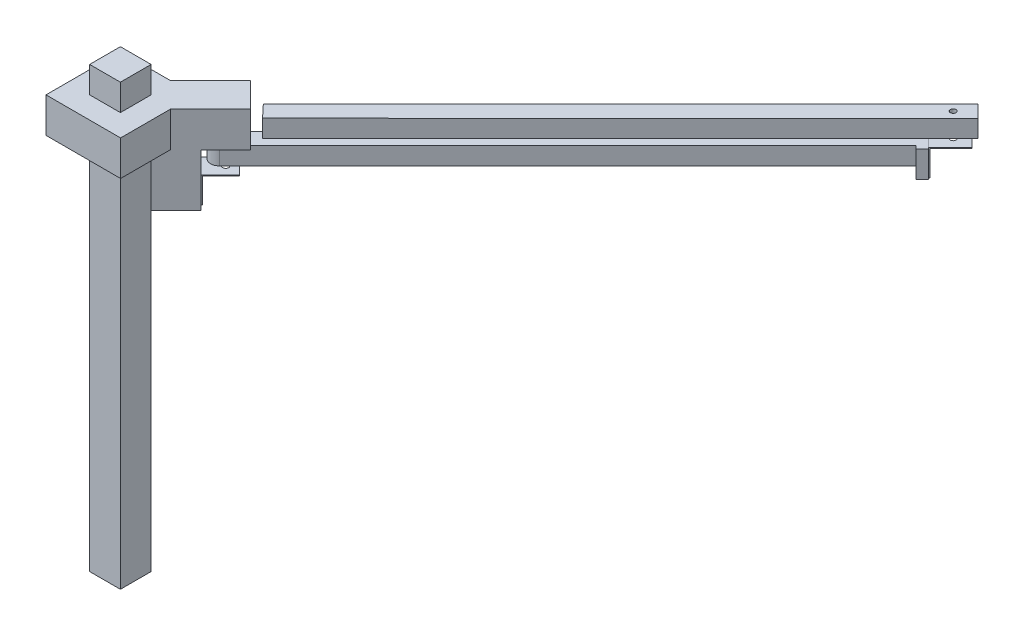
from build123d import *

# Parameters (mm, degrees)
SKETCH2_W                = 35
SKETCH2_H                = 35
BOSS_EXTRUDE1_DEPTH      = 500
BOSS_EXTRUDE2_DEPTH      = 20
BOSS_EXTRUDE2_DEPTH_BACK = 20
SKETCH6_W                = 84.911353559
SKETCH6_H                = 84.911353559
BOSS_EXTRUDE9_DEPTH      = 40
SKETCH7_W                = 25
SKETCH7_H                = 30
BOSS_EXTRUDE10_DEPTH     = 1.2
SKETCH9_W                = 25
SKETCH9_H                = 1.2
BOSS_EXTRUDE11_DEPTH     = 30
SKETCH10_R               = 3.5
CUT_EXTRUDE1_DEPTH       = 30
BOSS_EXTRUDE12_DEPTH     = 20
FILLET1_R                = 10
CUT_EXTRUDE2_DEPTH       = 20
CUT_EXTRUDE2_DEPTH_BACK  = 30
SKETCH15_W               = 30
SKETCH15_H               = 30
BOSS_EXTRUDE14_DEPTH     = 10
SKETCH16_W               = 25
SKETCH16_H               = 30
BOSS_EXTRUDE15_DEPTH     = 1.2
SKETCH17_W               = 25
SKETCH17_H               = 1.2
BOSS_EXTRUDE16_DEPTH     = 34
SKETCH18_R               = 3.192669461
CUT_EXTRUDE3_DEPTH       = 4
SKETCH19_R               = 3.192669461
BOSS_EXTRUDE18_DEPTH     = 20
SKETCH20_R               = 3.5
CUT_EXTRUDE4_DEPTH       = 20


with BuildPart() as part:
    # Sketch2 → Boss-Extrude1 (new body)
    with BuildSketch(Plane(origin=(0, 0, 0), x_dir=(1, 0, 0), z_dir=(0, 1, 0))):
        with Locations((-482.5, -482.5)):
            Rectangle(SKETCH2_W, SKETCH2_H)
    extrude(amount=-BOSS_EXTRUDE1_DEPTH)


with BuildPart() as body_2:
    # Sketch5 → Boss-Extrude2 (new, two sides: drawn at the far end of the back side and taken through both)
    with BuildSketch(Plane(origin=(0, 0, 0), x_dir=(0.7071067811865475, 0, -0.7071067811865477), z_dir=(0.7071067811865477, 0, 0.7071067811865475)).offset(-BOSS_EXTRUDE2_DEPTH_BACK)):
        Polygon((-657.609306503, -130), (-617.609306503, -130), (-617.609306503, -70), (-577.609306503, -70), (-577.609306503, -30), (-657.609306503, -30), align=None)
    extrude(amount=BOSS_EXTRUDE2_DEPTH + BOSS_EXTRUDE2_DEPTH_BACK)


with BuildPart() as body_3:
    # Sketch6 → Boss-Extrude9 (new body)
    with BuildSketch(Plane(origin=(0, -30, 0), x_dir=(1, 0, 0), z_dir=(0, 1, 0))):
        with Locations((-482.386838229, -482.386838229)):
            Rectangle(SKETCH6_W, SKETCH6_H)
    extrude(amount=-BOSS_EXTRUDE9_DEPTH)


with BuildPart() as body_2_1:
    add(body_2.part)

    # Combine2: union body 3
    add(body_3.part)

    # Sketch7 → Boss-Extrude10 (add)
    with BuildSketch(Plane(origin=(-436.715728753, 0, 436.715728753), x_dir=(-0.7071067811865476, 0, -0.7071067811865476), z_dir=(0.7071067811865476, 0, -0.7071067811865476))):
        with Locations((0, -115)):
            Rectangle(SKETCH7_W, SKETCH7_H)
    extrude(amount=BOSS_EXTRUDE10_DEPTH)

    # Sketch9 → Boss-Extrude11 (add)
    with BuildSketch(Plane(origin=(-435.867200615, 0, 435.867200615), x_dir=(-0.7071067811865475, 0, -0.7071067811865477), z_dir=(0.7071067811865477, 0, -0.7071067811865475))):
        with Locations((0, -100.6)):
            Rectangle(SKETCH9_W, SKETCH9_H)
    extrude(amount=BOSS_EXTRUDE11_DEPTH)

    # Sketch10 → Cut-Extrude1 (cut)
    with BuildSketch(Plane(origin=(0, -100, 0), x_dir=(1, 0, 0), z_dir=(0, 1, 0))):
        with Locations(Location((-422.573593129, -422.573593129, 0), (0, 0, 270))):
            Circle(SKETCH10_R)
    extrude(amount=-CUT_EXTRUDE1_DEPTH, mode=Mode.SUBTRACT)


with BuildPart() as body_3_2:
    # Sketch13 → Boss-Extrude12 (new body)
    with BuildSketch(Plane(origin=(0, -93, 0), x_dir=(1, 0, 0), z_dir=(0, 1, 0))):
        Polygon((-440.251262658, -426.109127035), (-426.109127035, -440.251262658), (7.071067812, -7.071067812), (-7.071067812, 7.071067812), align=None)
    extrude(amount=BOSS_EXTRUDE12_DEPTH)

    # Fillet1
    fillet1_edges = [body_3_2.edges().sort_by_distance(p)[0] for p in [
        (-440.251262658, -83, 426.109127035),
        (-426.109127035, -83, 440.251262658),
    ]]
    fillet(fillet1_edges, radius=FILLET1_R - 0.0001)  # a hair under: the kernel refuses the full size

    # Sketch14 → Cut-Extrude2 (cut, two sides: drawn at the far end of the back side and taken through both)
    with BuildSketch(Plane(origin=(0, -73, 0), x_dir=(1, 0, 0), z_dir=(0, 1, 0)).offset(-CUT_EXTRUDE2_DEPTH_BACK)):
        Polygon((-38.774344763, -6.480489233), (-6.480489233, -38.774344763), (24.367106229, -7.926749301), (-7.926749301, 24.367106229), align=None)
    extrude(amount=CUT_EXTRUDE2_DEPTH + CUT_EXTRUDE2_DEPTH_BACK, mode=Mode.SUBTRACT)

    # Sketch15 → Boss-Extrude14 (add)
    with BuildSketch(Plane(origin=(-22.627416998, 0, 22.627416998), x_dir=(-0.7071067811865561, 0, -0.7071067811865389), z_dir=(0.7071067811865389, 0, -0.7071067811865561))):
        with Locations((0, -88)):
            Rectangle(SKETCH15_W, SKETCH15_H)
    extrude(amount=-BOSS_EXTRUDE14_DEPTH)

    # Sketch20 → Cut-Extrude4 (cut)
    with BuildSketch(Plane.XZ.offset(93)):
        with Locations(Location((-422.573593129, 422.573593129, 0), (0, 0, 270))):
            Circle(SKETCH20_R)
    extrude(amount=-CUT_EXTRUDE4_DEPTH, mode=Mode.SUBTRACT)


with BuildPart() as body_4:
    # Sketch16 → Boss-Extrude15 (new body)
    with BuildSketch(Plane(origin=(-22.627416998, 0, 22.627416998), x_dir=(-0.7071067811865561, 0, -0.7071067811865389), z_dir=(0.7071067811865389, 0, -0.7071067811865561))):
        with Locations((0, -88)):
            Rectangle(SKETCH16_W, SKETCH16_H)
    extrude(amount=BOSS_EXTRUDE15_DEPTH)

    # Sketch17 → Boss-Extrude16 (add)
    with BuildSketch(Plane(origin=(-21.778888861, 0, 21.778888861), x_dir=(-0.7071067811865561, 0, -0.7071067811865389), z_dir=(0.7071067811865389, 0, -0.7071067811865561))):
        with Locations((0, -73.6)):
            Rectangle(SKETCH17_W, SKETCH17_H)
    extrude(amount=BOSS_EXTRUDE16_DEPTH)

    # Sketch18 → Cut-Extrude3 (cut)
    with BuildSketch(Plane(origin=(0, -73, 0), x_dir=(1, 0, 0), z_dir=(0, 1, 0))):
        with Locations(Location((-8.485281374, -8.485281374, 0), (0, 0, 270))):
            Circle(SKETCH18_R)
    extrude(amount=-CUT_EXTRUDE3_DEPTH, mode=Mode.SUBTRACT)


with BuildPart() as body_5:
    # Sketch19 → Boss-Extrude18 (new body)
    with BuildSketch(Plane(origin=(0, -66, 0), x_dir=(1, 0, 0), z_dir=(0, 1, 0))):
        Polygon((-1.414213562, 12.727922061), (12.727922061, -1.414213562), (-394.524128884, -408.658714032), (-408.196650502, -394.062065355), align=None)
        with Locations(Location((-8.485281374, -8.485281374, 0), (0, 0, 270))):
            Circle(SKETCH19_R, mode=Mode.SUBTRACT)
    extrude(amount=BOSS_EXTRUDE18_DEPTH)


solid = Compound([part.part, body_2_1.part, body_3_2.part, body_4.part, body_5.part])
